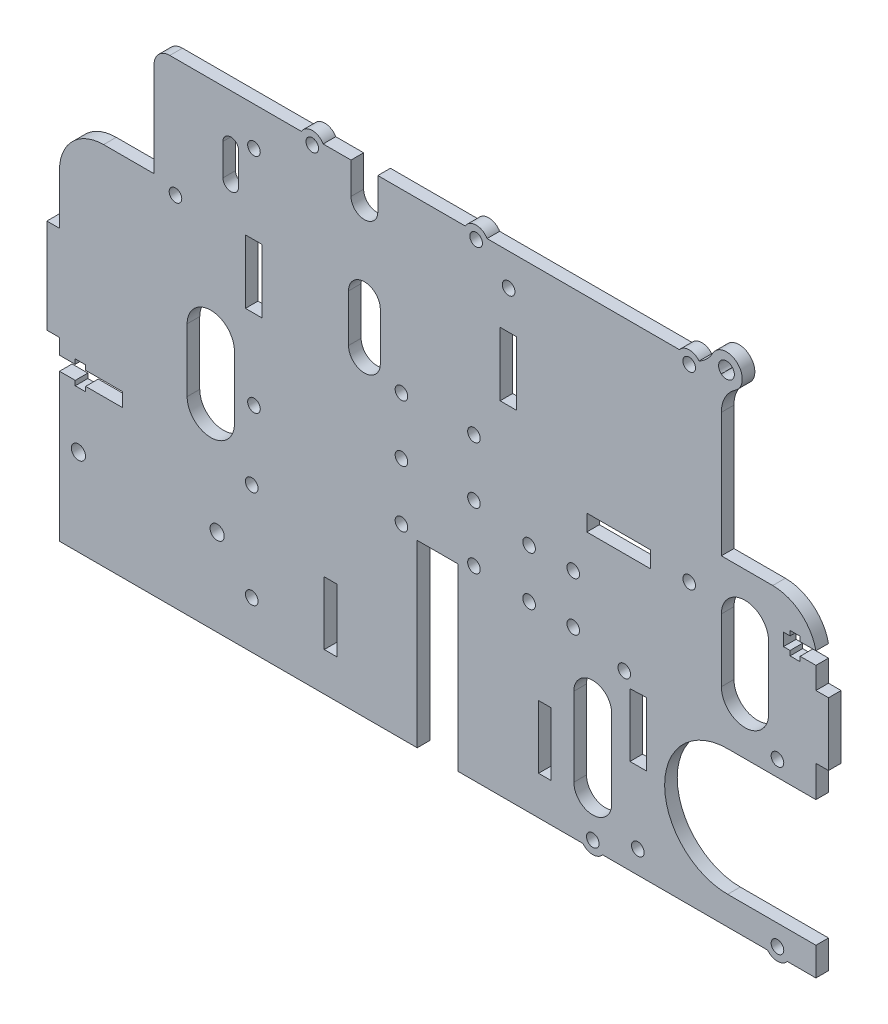
from build123d import *

# Parameters (mm, degrees)
SKETCH1_W           = 240
SKETCH1_H           = 151
BOSS_EXTRUDE1_DEPTH = 4
SKETCH3_W           = 13
SKETCH3_H           = 57
CUT_EXTRUDE2_DEPTH  = 10
SKETCH6_R           = 2
CUT_EXTRUDE5_DEPTH  = 10
SKETCH7_R           = 2
CUT_EXTRUDE6_DEPTH  = 10
CUT_EXTRUDE7_DEPTH  = 10
SKETCH9_R           = 2
CUT_EXTRUDE8_DEPTH  = 10
SKETCH10_R          = 4
SKETCH10_R_2        = 2
BOSS_EXTRUDE2_DEPTH = 4
CUT_EXTRUDE10_DEPTH = 10
SKETCH13_W          = 30
SKETCH13_H          = 35
CUT_EXTRUDE11_DEPTH = 10
SKETCH16_R          = 2
CUT_EXTRUDE13_DEPTH = 5
CUT_EXTRUDE14_DEPTH = 5
CUT_EXTRUDE15_DEPTH = 5
SKETCH20_W          = 5.2
SKETCH20_H          = 20.2
CUT_EXTRUDE17_DEPTH = 10
SKETCH21_R          = 2
CUT_EXTRUDE18_DEPTH = 10
CUT_EXTRUDE20_DEPTH = 5
SKETCH25_R          = 2
CUT_EXTRUDE21_DEPTH = 5
SKETCH26_R          = 2
CUT_EXTRUDE22_DEPTH = 10
SKETCH27_R          = 4
SKETCH27_R_2        = 2
BOSS_EXTRUDE4_DEPTH = 4
SKETCH28_W          = 5.2
SKETCH28_H          = 20.2
CUT_EXTRUDE23_DEPTH = 5
SKETCH29_W          = 20.2
SKETCH29_H          = 5.2
CUT_EXTRUDE24_DEPTH = 5
SKETCH30_R          = 2
CUT_EXTRUDE25_DEPTH = 5
SKETCH31_R          = 4
SKETCH31_R_2        = 2
BOSS_EXTRUDE5_DEPTH = 4
SKETCH33_W          = 4
SKETCH33_H          = 30
SKETCH33_H_2        = 20
BOSS_EXTRUDE6_DEPTH = 4
SKETCH34_R          = 2.25
CUT_EXTRUDE27_DEPTH = 5
CUT_EXTRUDE28_DEPTH = 5
SKETCH36_R          = 2
CUT_EXTRUDE29_DEPTH = 5
SKETCH37_R          = 2
CUT_EXTRUDE30_DEPTH = 10
SKETCH38_R          = 2
CUT_EXTRUDE31_DEPTH = 10
CUT_EXTRUDE32_DEPTH = 10
FILLET2_R           = 5
SKETCH41_R          = 5
SKETCH41_R_2        = 2.5
BOSS_EXTRUDE7_DEPTH = 4
FILLET3_R           = 10
CUT_EXTRUDE34_DEPTH = 5
FILLET4_R           = 14
SKETCH44_W          = 30
SKETCH44_H          = 15
CUT_EXTRUDE35_DEPTH = 10
FILLET5_R           = 14
SKETCH46_W          = 4
SKETCH46_H          = 20
CUT_EXTRUDE37_DEPTH = 10


with BuildPart() as part:
    # Sketch1 → Boss-Extrude1 (new body)
    with BuildSketch(Plane.XY):
        Rectangle(SKETCH1_W, SKETCH1_H)
    extrude(amount=BOSS_EXTRUDE1_DEPTH)

    # Sketch3 → Cut-Extrude2 (cut)
    with BuildSketch(Plane(origin=(0, 0, 0), x_dir=(-1, 0, 0), z_dir=(0, 0, -1))):
        with Locations((0, -47)):
            Rectangle(SKETCH3_W, SKETCH3_H)
    extrude(amount=-CUT_EXTRUDE2_DEPTH, mode=Mode.SUBTRACT)

    # Sketch6 → Cut-Extrude5 (cut)
    with BuildSketch(Plane(origin=(0, 0, 0), x_dir=(-1, 0, 0), z_dir=(0, 0, -1))):
        with Locations((11.5, 19.5)):
            Circle(SKETCH6_R)
        with Locations((11.5, 1.5)):
            Circle(SKETCH6_R)
        with Locations((11.5, -16.5)):
            Circle(SKETCH6_R)
        with Locations(Location((-11.5, -16.5, 0), (0, 0, 180))):
            Circle(SKETCH6_R)
        with Locations(Location((-11.5, 1.5, 0), (0, 0, 180))):
            Circle(SKETCH6_R)
        with Locations(Location((-11.5, 19.5, 0), (0, 0, 180))):
            Circle(SKETCH6_R)
    extrude(amount=-CUT_EXTRUDE5_DEPTH, mode=Mode.SUBTRACT)

    # Sketch7 → Cut-Extrude6 (cut)
    with BuildSketch(Plane(origin=(0, 0, 0), x_dir=(-1, 0, 0), z_dir=(0, 0, -1))):
        with Locations((-43, -2.1)):
            Circle(SKETCH7_R)
        with Locations((-43, -17.6)):
            Circle(SKETCH7_R)
        with Locations(Location((-29, -17.6, 0), (0, 0, 180))):
            Circle(SKETCH7_R)
        with Locations(Location((-29, -2.1, 0), (0, 0, 180))):
            Circle(SKETCH7_R)
    extrude(amount=-CUT_EXTRUDE6_DEPTH, mode=Mode.SUBTRACT)

    # Sketch8 → Cut-Extrude7 (cut)
    with BuildSketch(Plane(origin=(0, 0, 0), x_dir=(-1, 0, 0), z_dir=(0, 0, -1))):
        with BuildLine():
            Line((-120, -26.5), (-92, -26.5))
            ThreePointArc((-92, -26.5), (-72, -46.5), (-92, -66.5))
            Line((-92, -66.5), (-120, -66.5))
            Line((-120, -66.5), (-120, -26.5))
        make_face()
    extrude(amount=-CUT_EXTRUDE7_DEPTH, mode=Mode.SUBTRACT)

    # Sketch9 → Cut-Extrude8 (cut)
    with BuildSketch(Plane(origin=(0, 0, 0), x_dir=(-1, 0, 0), z_dir=(0, 0, -1))):
        with Locations((-59.2, -21.5)):
            Circle(SKETCH9_R)
        with Locations((-107.8, -21.5)):
            Circle(SKETCH9_R)
        with Locations((-49.2, -73)):
            Circle(SKETCH9_R)
        with Locations((-107.8, -73)):
            Circle(SKETCH9_R)
    extrude(amount=-CUT_EXTRUDE8_DEPTH, mode=Mode.SUBTRACT)

    # Sketch10 → Boss-Extrude2 (add)
    # profile 1 of 2: a face of its own
    with BuildSketch(Plane(origin=(0, 0, 0), x_dir=(-1, 0, 0), z_dir=(0, 0, -1))):
        with Locations((-107.8, -73)):
            Circle(SKETCH10_R)
        with Locations((-107.8, -73)):
            Circle(SKETCH10_R_2, mode=Mode.SUBTRACT)
    # profile 2 of 2: a face of its own
    with BuildSketch(Plane(origin=(0, 0, 0), x_dir=(-1, 0, 0), z_dir=(0, 0, -1))):
        with Locations((-49.2, -73)):
            Circle(SKETCH10_R)
        with Locations((-49.2, -73)):
            Circle(SKETCH10_R_2, mode=Mode.SUBTRACT)
    extrude(amount=-BOSS_EXTRUDE2_DEPTH)

    # Sketch12 → Cut-Extrude10 (cut)
    with BuildSketch(Plane(origin=(0, 0, 0), x_dir=(-1, 0, 0), z_dir=(0, 0, -1))):
        with BuildLine():
            Line((-43.2, -35.107061825), (-43.2, -60.107061825))
            ThreePointArc((-43.2, -60.107061825), (-49.2, -66.107061825), (-55.2, -60.107061825))
            Line((-55.2, -60.107061825), (-55.2, -35.107061825))
            ThreePointArc((-55.2, -35.107061825), (-49.2, -29.107061825), (-43.2, -35.107061825))
        make_face()
    extrude(amount=-CUT_EXTRUDE10_DEPTH, mode=Mode.SUBTRACT)

    # Sketch13 → Cut-Extrude11 (cut)
    with BuildSketch(Plane(origin=(0, 0, 0), x_dir=(-1, 0, 0), z_dir=(0, 0, -1))):
        with Locations((-105, 58)):
            Rectangle(SKETCH13_W, SKETCH13_H)
        with Locations((105, 58)):
            Rectangle(SKETCH13_W, SKETCH13_H)
    extrude(amount=-CUT_EXTRUDE11_DEPTH, mode=Mode.SUBTRACT)

    # Sketch16 → Cut-Extrude13 (cut)
    with BuildSketch(Plane(origin=(0, 0, 0), x_dir=(-1, 0, 0), z_dir=(0, 0, -1))):
        with Locations((59, -29.5)):
            Circle(SKETCH16_R)
        with Locations((59, -60.5)):
            Circle(SKETCH16_R)
    extrude(amount=-CUT_EXTRUDE13_DEPTH, mode=Mode.SUBTRACT)

    # Sketch17 → Cut-Extrude14 (cut)
    with BuildSketch(Plane(origin=(0, 0, 0), x_dir=(-1, 0, 0), z_dir=(0, 0, -1))):
        with BuildLine():
            Line((-90, 9.536909767), (-90, -10.463090233))
            ThreePointArc((-90, -10.463090233), (-97.5, -17.963090233), (-105, -10.463090233))
            Line((-105, -10.463090233), (-105, 9.536909767))
            ThreePointArc((-105, 9.536909767), (-97.5, 17.036909767), (-90, 9.536909767))
        make_face()
    extrude(amount=-CUT_EXTRUDE14_DEPTH, mode=Mode.SUBTRACT)

    # Sketch18 → Cut-Extrude15 (cut)
    with BuildSketch(Plane(origin=(0, 0, 0), x_dir=(-1, 0, 0), z_dir=(0, 0, -1))):
        with BuildLine():
            Line((64.5, -15.5), (64.5, 4.5))
            ThreePointArc((64.5, 4.5), (72, 12), (79.5, 4.5))
            Line((79.5, 4.5), (79.5, -15.5))
            ThreePointArc((79.5, -15.5), (72, -23), (64.5, -15.5))
        make_face()
    extrude(amount=-CUT_EXTRUDE15_DEPTH, mode=Mode.SUBTRACT)

    # Sketch20 → Cut-Extrude17 (cut)
    with BuildSketch(Plane(origin=(0, 0, 0), x_dir=(-1, 0, 0), z_dir=(0, 0, -1))):
        with Locations((58.395562695, 28.1)):
            Rectangle(SKETCH20_W, SKETCH20_H)
    extrude(amount=-CUT_EXTRUDE17_DEPTH, mode=Mode.SUBTRACT)

    # Sketch21 → Cut-Extrude18 (cut)
    with BuildSketch(Plane(origin=(0, 0, 0), x_dir=(-1, 0, 0), z_dir=(0, 0, -1))):
        with Locations((58.295562695, -7.3)):
            Circle(SKETCH21_R)
        with Locations((58.295562695, 63.3)):
            Circle(SKETCH21_R)
    extrude(amount=-CUT_EXTRUDE18_DEPTH, mode=Mode.SUBTRACT)

    # Sketch24 → Cut-Extrude20 (cut)
    with BuildSketch(Plane.XY.offset(4)):
        Polygon((66.2, -45.5), (66.196152437, -25.300000366), (61, -25.5), (61, -45.5), align=None)
    extrude(amount=-CUT_EXTRUDE20_DEPTH, mode=Mode.SUBTRACT)

    # Sketch25 → Cut-Extrude21 (cut)
    with BuildSketch(Plane(origin=(0, 0, 0), x_dir=(-1, 0, 0), z_dir=(0, 0, -1))):
        with Locations((-63.5, -68.3)):
            Circle(SKETCH25_R)
    extrude(amount=-CUT_EXTRUDE21_DEPTH, mode=Mode.SUBTRACT)

    # Sketch26 → Cut-Extrude22 (cut)
    with BuildSketch(Plane(origin=(0, 0, 0), x_dir=(-1, 0, 0), z_dir=(0, 0, -1))):
        with Locations((39.8, 73.49)):
            Circle(SKETCH26_R)
        with Locations((-12.2, 73.49)):
            Circle(SKETCH26_R)
    extrude(amount=-CUT_EXTRUDE22_DEPTH, mode=Mode.SUBTRACT)

    # Sketch27 → Boss-Extrude4 (add)
    # profile 1 of 2: a face of its own
    with BuildSketch(Plane(origin=(0, 0, 0), x_dir=(-1, 0, 0), z_dir=(0, 0, -1))):
        with Locations((39.8, 73.49)):
            Circle(SKETCH27_R)
        with Locations((39.8, 73.49)):
            Circle(SKETCH27_R_2, mode=Mode.SUBTRACT)
    # profile 2 of 2: a face of its own
    with BuildSketch(Plane(origin=(0, 0, 0), x_dir=(-1, 0, 0), z_dir=(0, 0, -1))):
        with Locations((-12.2, 73.49)):
            Circle(SKETCH27_R)
        with Locations((-12.2, 73.49)):
            Circle(SKETCH27_R_2, mode=Mode.SUBTRACT)
    extrude(amount=-BOSS_EXTRUDE4_DEPTH)

    # Sketch28 → Cut-Extrude23 (cut)
    with BuildSketch(Plane.XY.offset(4)):
        with Locations((22.4, 43.1)):
            Rectangle(SKETCH28_W, SKETCH28_H)
    extrude(amount=-CUT_EXTRUDE23_DEPTH, mode=Mode.SUBTRACT)

    # Sketch29 → Cut-Extrude24 (cut)
    with BuildSketch(Plane.XY.offset(4)):
        with Locations((57.4, 13.3)):
            Rectangle(SKETCH29_W, SKETCH29_H)
    extrude(amount=-CUT_EXTRUDE24_DEPTH, mode=Mode.SUBTRACT)

    # Sketch30 → Cut-Extrude25 (cut)
    with BuildSketch(Plane(origin=(0, 0, 0), x_dir=(-1, 0, 0), z_dir=(0, 0, -1))):
        with Locations((-79.8, 73)):
            Circle(SKETCH30_R)
    extrude(amount=-CUT_EXTRUDE25_DEPTH, mode=Mode.SUBTRACT)

    # Sketch31 → Boss-Extrude5 (add)
    with BuildSketch(Plane(origin=(0, 0, 0), x_dir=(-1, 0, 0), z_dir=(0, 0, -1))):
        with Locations((-79.8, 73)):
            Circle(SKETCH31_R)
        with Locations((-79.8, 73)):
            Circle(SKETCH31_R_2, mode=Mode.SUBTRACT)
    extrude(amount=-BOSS_EXTRUDE5_DEPTH)

    # Sketch33 → Boss-Extrude6 (add)
    with BuildSketch(Plane(origin=(0, 0, 0), x_dir=(-1, 0, 0), z_dir=(0, 0, -1))):
        with Locations((122, -4.5)):
            Rectangle(SKETCH33_W, SKETCH33_H)
        with Locations((-122, -6.5)):
            Rectangle(SKETCH33_W, SKETCH33_H_2)
    extrude(amount=-BOSS_EXTRUDE6_DEPTH)

    # Sketch34 → Cut-Extrude27 (cut)
    with BuildSketch(Plane(origin=(0, 0, 0), x_dir=(-1, 0, 0), z_dir=(0, 0, -1))):
        with Locations((113.98, -48)):
            Circle(SKETCH34_R)
        with Locations((69.98, -48)):
            Circle(SKETCH34_R)
    extrude(amount=-CUT_EXTRUDE27_DEPTH, mode=Mode.SUBTRACT)

    # Sketch35 → Cut-Extrude28 (cut)
    with BuildSketch(Plane(origin=(0, 0, 0), x_dir=(-1, 0, 0), z_dir=(0, 0, -1))):
        Polygon((-120, 14.405611853), (-115, 14.405611853), (-115, 15.905611853), (-111.8, 15.905611853), (-111.8, 14.405611853), (-109.705118332, 14.405611853), (-109.705118332, 10.405611853), (-111.8, 10.405611853), (-111.8, 8.905611853), (-115, 8.905611853), (-115, 10.405611853), (-120, 10.405611853), align=None)
        Polygon((100, -24.37851787), (111.7, -24.37851787), (111.7, -22.87851787), (115, -22.87851787), (115, -24.37851787), (120, -24.37851787), (120, -28.77851787), (115, -28.77851787), (115, -30.27851787), (111.7, -30.27851787), (111.7, -28.77851787), (100, -28.77851787), align=None)
    extrude(amount=-CUT_EXTRUDE28_DEPTH, mode=Mode.SUBTRACT)

    # Sketch36 → Cut-Extrude29 (cut)
    with BuildSketch(Plane(origin=(0, 0, 0), x_dir=(-1, 0, 0), z_dir=(0, 0, -1))):
        with Locations((-22.5, 65.3)):
            Circle(SKETCH36_R)
    extrude(amount=-CUT_EXTRUDE29_DEPTH, mode=Mode.SUBTRACT)

    # Sketch37 → Cut-Extrude30 (cut)
    with BuildSketch(Plane(origin=(0, 0, 0), x_dir=(-1, 0, 0), z_dir=(0, 0, -1))):
        with Locations((-79.8, 13.2)):
            Circle(SKETCH37_R)
    extrude(amount=-CUT_EXTRUDE30_DEPTH, mode=Mode.SUBTRACT)

    # Sketch38 → Cut-Extrude31 (cut)
    with BuildSketch(Plane(origin=(0, 0, 0), x_dir=(-1, 0, 0), z_dir=(0, 0, -1))):
        with Locations((83.2, 38)):
            Circle(SKETCH38_R)
    extrude(amount=-CUT_EXTRUDE31_DEPTH, mode=Mode.SUBTRACT)

    # Sketch39 → Cut-Extrude32 (cut)
    with BuildSketch(Plane(origin=(0, 0, 0), x_dir=(-1, 0, 0), z_dir=(0, 0, -1))):
        with BuildLine():
            Line((68.144700817, 60.273962469), (68.144700817, 50.273962469))
            ThreePointArc((68.144700817, 50.273962469), (65.644700817, 47.773962469), (63.144700817, 50.273962469))
            Line((63.144700817, 50.273962469), (63.144700817, 60.273962469))
            ThreePointArc((63.144700817, 60.273962469), (65.644700817, 62.773962469), (68.144700817, 60.273962469))
        make_face()
    extrude(amount=-CUT_EXTRUDE32_DEPTH, mode=Mode.SUBTRACT)

    # Fillet2
    fillet2_edges = [part.edges().sort_by_distance(p)[0] for p in [
        (-90, 75.5, 2),
    ]]
    fillet(fillet2_edges, radius=FILLET2_R)

    # Sketch41 → Boss-Extrude7 (add)
    with BuildSketch(Plane(origin=(0, 0, 0), x_dir=(-1, 0, 0), z_dir=(0, 0, -1))):
        with Locations((-91.621883277, 77.367881047)):
            Circle(SKETCH41_R)
        with Locations((-91.621883277, 77.367881047)):
            Circle(SKETCH41_R_2, mode=Mode.SUBTRACT)
    extrude(amount=-BOSS_EXTRUDE7_DEPTH)

    # Fillet3
    # the kernel refuses this fillet: 10 mm, written as the material it adds along each edge
    with BuildSketch(Plane(origin=(86.983885822, 75.5, 4), x_dir=(0.05276655302532394, 0.998606875042339, 0), z_dir=(0, 0, -1))) as fillet3_piece_1:
        with BuildLine():
            CenterArc((8.440039974, -9.065949002), FILLET3_R, 114.961046701, 34.971313941)
            Line((-0.214305383, -4.055728803), (-0.38739229, -3.955524399))
            ThreePointArc((-0.38739229, -3.955524399), (-0.306874067, -2.017311091), (-0.199721375, 0.010553311))
            Line((-0.199721375, 0.010553311), (0.0844004, 0.18131898))
            ThreePointArc((0.0844004, 0.18131898), (2.110009993, -0.267025499), (4.135619587, 0.18131898))
            Line((4.135619587, 0.18131898), (4.220019987, 0))
        make_face()
    extrude(amount=4)
    with BuildSketch(Plane(origin=(90, 72.638241035, 4), x_dir=(0, -1, 0), z_dir=(0, 0, -1))) as fillet3_piece_2:
        with BuildLine():
            CenterArc((7.712512543, -10), FILLET3_R, 90, 56.045033959)
            Line((-0.582255827, -4.414588851), (-0.748151194, -4.302880628))
            ThreePointArc((-0.748151194, -4.302880628), (0.029146738, -2.249536589), (-0.1891856, -0.064875331))
            Line((-0.1891856, -0.064875331), (0, 0.2))
            Line((0, 0.2), (7.712512543, 0.2))
            Line((7.712512543, 0.2), (7.712512543, 0))
        make_face()
    extrude(amount=4)

    # Sketch43 → Cut-Extrude34 (cut)
    with BuildSketch(Plane(origin=(0, 0, 0), x_dir=(-1, 0, 0), z_dir=(0, 0, -1))):
        with BuildLine():
            Line((27.5, 75.5), (27.5, 65.5))
            ThreePointArc((27.5, 65.5), (23.25, 61.25), (19, 65.5))
            Line((19, 65.5), (19, 75.5))
            ThreePointArc((19, 75.5), (23.25, 79.75), (27.5, 75.5))
        make_face()
        with BuildLine():
            Line((18.207954817, 24.148550424), (18.207954817, 39.148550424))
            ThreePointArc((18.207954817, 39.148550424), (23.25, 44.190595606), (28.292045182, 39.148550424))
            Line((28.292045182, 39.148550424), (28.292045182, 24.148550424))
            ThreePointArc((28.292045182, 24.148550424), (23.25, 19.106505241), (18.207954817, 24.148550424))
        make_face()
    extrude(amount=-CUT_EXTRUDE34_DEPTH, mode=Mode.SUBTRACT)

    # Fillet4
    fillet4_edges = [part.edges().sort_by_distance(p)[0] for p in [
        (-120, 40.5, 2),
    ]]
    fillet(fillet4_edges, radius=FILLET4_R)

    # Sketch44 → Cut-Extrude35 (cut)
    with BuildSketch(Plane(origin=(0, 0, 0), x_dir=(-1, 0, 0), z_dir=(0, 0, -1))):
        with Locations((-105, 33)):
            Rectangle(SKETCH44_W, SKETCH44_H)
    extrude(amount=-CUT_EXTRUDE35_DEPTH, mode=Mode.SUBTRACT)

    # Fillet5
    # the kernel refuses this fillet: 14 mm, written as the material it takes off along each edge
    with BuildSketch(Plane(origin=(120, 25.5, -34.237901126), x_dir=(-1, 0, 0), z_dir=(0, 0, 1))) as fillet5_piece_1:
        with BuildLine():
            CenterArc((13.69516045, 14), FILLET5_R, 191.978445727, 78.021554273)
            Line((0, 11.094388147), (-0.273903209, 11.03627591))
            ThreePointArc((-0.273903209, 11.03627591), (-0.28, 5.547194073), (-0.28, 0))
            Line((-0.28, 0), (0, -0.28))
            Line((0, -0.28), (13.69516045, -0.28))
            Line((13.69516045, -0.28), (13.69516045, 0))
        make_face()
    extrude(amount=72.475802251, mode=Mode.SUBTRACT)

    # Sketch46 → Cut-Extrude37 (cut)
    with BuildSketch(Plane(origin=(0, 0, 0), x_dir=(-1, 0, 0), z_dir=(0, 0, -1))):
        with Locations((-34, -53.25)):
            Rectangle(SKETCH46_W, SKETCH46_H)
        with Locations((34, -53.25)):
            Rectangle(SKETCH46_W, SKETCH46_H)
    extrude(amount=-CUT_EXTRUDE37_DEPTH, mode=Mode.SUBTRACT)


solid = part.part
